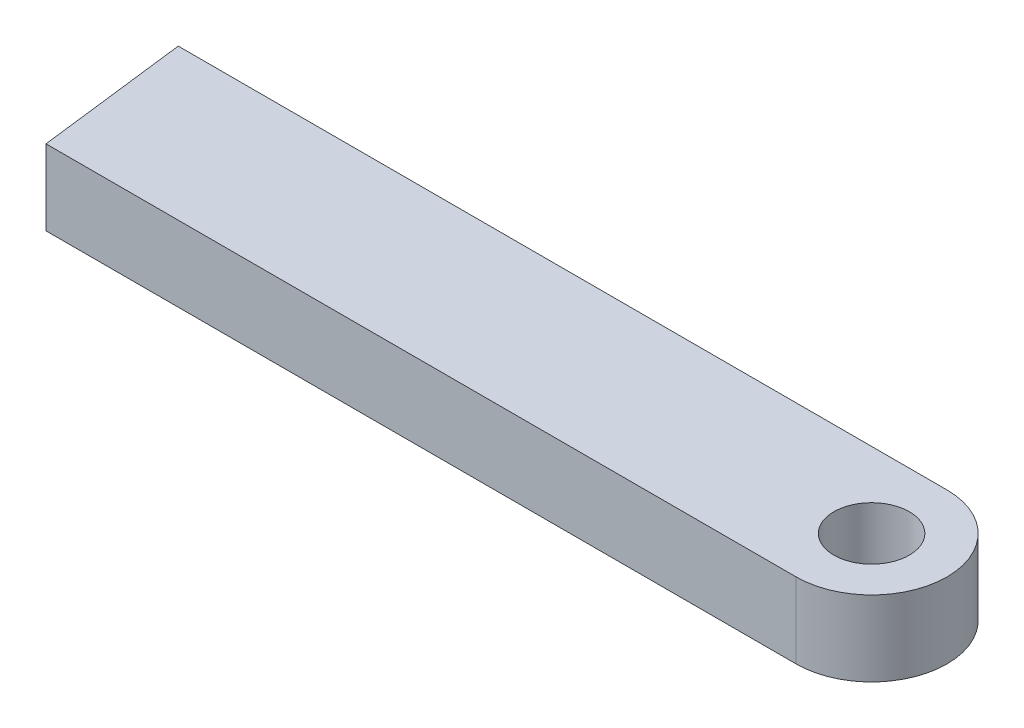
from build123d import *

# Parameters (mm, degrees)
ESQUISSE1_R                     = 2.5
BOSS_EXTRU_1_DEPTH              = 2.5
TROU_TARAUD_M3X0_51_D           = 2.5
TROU_TARAUD_M3X0_51_DEPTH       = 12.5
TROU_TARAUD_M3X0_51_CSINK_D     = 3.05
TROU_TARAUD_M3X0_51_CSINK_ANGLE = 90
TROU_TARAUD_M3X0_51_TIP         = 0.751075774


with BuildPart() as part:
    # Esquisse1 → Boss.-Extru.1 (new, symmetric)
    with BuildSketch(Plane(origin=(0, 0, 0), x_dir=(1, 0, 0), z_dir=(0, 1, 0))):
        with BuildLine():
            Line((-49.761568468, -5), (0, -5))
            ThreePointArc((0, -5), (5, 0), (0, 5))
            Line((0, 5), (-50.989414077, 5))
            Line((-50.989414077, 5), (-49.761568468, -5))
        make_face()
        Circle(ESQUISSE1_R, mode=Mode.SUBTRACT)
    extrude(amount=BOSS_EXTRU_1_DEPTH, both=True)

    # Trou taraudé M3x0.51
    with Locations(Plane(origin=(-49.627307582, 0, 6.09346717), x_dir=(0.12186934340515178, 0, 0.9925461516413215), z_dir=(-0.9925461516413215, 0, 0.12186934340515178))):
        with Locations((-6.139228045, -0.25)):
            CounterSinkHole(TROU_TARAUD_M3X0_51_D / 2, TROU_TARAUD_M3X0_51_CSINK_D / 2, depth=TROU_TARAUD_M3X0_51_DEPTH, counter_sink_angle=TROU_TARAUD_M3X0_51_CSINK_ANGLE)
            with Locations((0, 0, -(TROU_TARAUD_M3X0_51_DEPTH + TROU_TARAUD_M3X0_51_TIP / 2))):  # 118° drill point
                Cone(0, TROU_TARAUD_M3X0_51_D / 2, TROU_TARAUD_M3X0_51_TIP, mode=Mode.SUBTRACT)


solid = part.part
